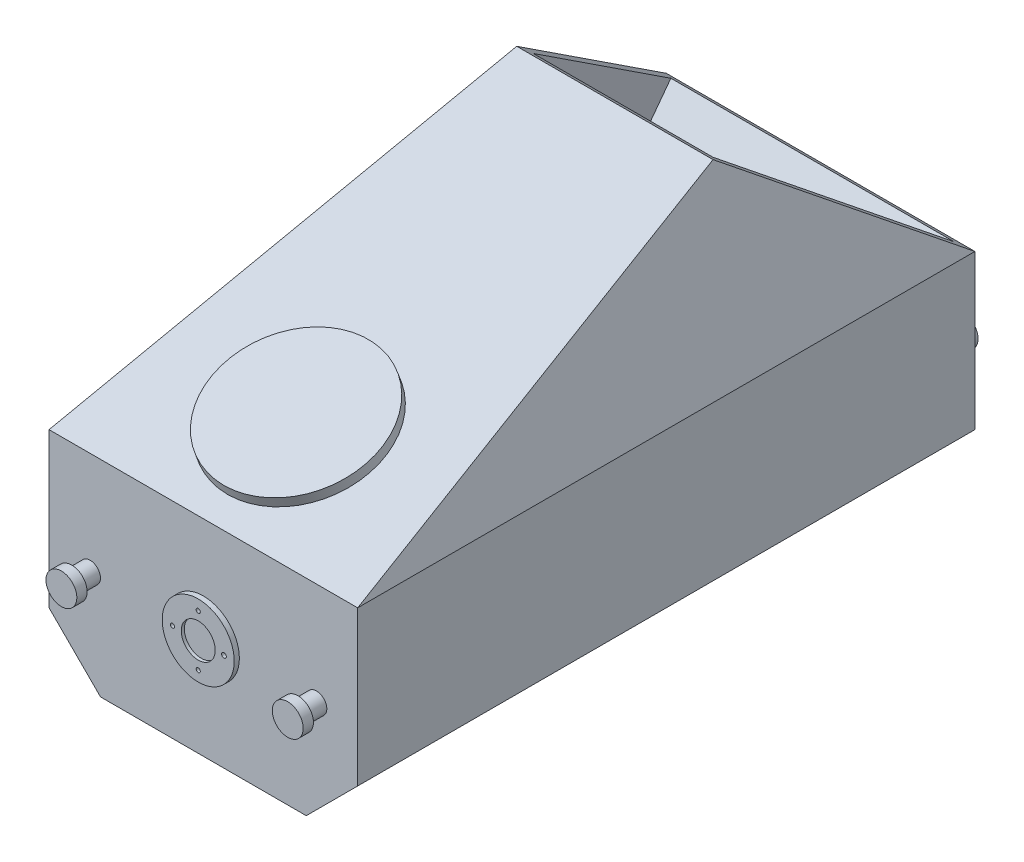
from build123d import *

# Parameters (mm, degrees)
SKETCH3_W            = 300
SKETCH3_H            = 200
BOSS_EXTRUDE2_DEPTH  = 300
SKETCH8_R            = 35
SKETCH8_R_2          = 2
SKETCH8_R_3          = 2.3
BOSS_EXTRUDE7_DEPTH  = 5
BOSS_EXTRUDE8_DEPTH  = 300
SKETCH19_W           = 200
SKETCH19_H           = 260
CUT_EXTRUDE5_DEPTH   = 150
CUT_EXTRUDE3_REACH   = 673.584
CUT_EXTRUDE4_DEPTH   = 200
CHAMFER2_SIZE        = 50
SKETCH4_R            = 10
BOSS_EXTRUDE9_DEPTH  = 18
SKETCH15_R           = 15
BOSS_EXTRUDE10_DEPTH = 10
BOSS_EXTRUDE11_START = 18
SKETCH16_R           = 10
BOSS_EXTRUDE11_DEPTH = 18
BOSS_EXTRUDE12_START = 10
SKETCH17_R           = 15
BOSS_EXTRUDE12_DEPTH = 10
SKETCH18_R           = 75
BOSS_EXTRUDE13_DEPTH = 10
CUT_EXTRUDE6_REACH   = 685.318
SKETCH20_R           = 35
SKETCH21_R           = 16.5
CUT_EXTRUDE7_DEPTH   = 3
CUT_EXTRUDE8_START   = -3
SKETCH22_R           = 16.5
CUT_EXTRUDE8_DEPTH   = 3
SKETCH23_R           = 2
SKETCH23_R_2         = 2.3
CUT_EXTRUDE9_DEPTH   = 20


with BuildPart() as part:
    # Sketch3 → Boss-Extrude2 (new body)
    with BuildSketch(Plane.XY):
        Rectangle(SKETCH3_W, SKETCH3_H)
    extrude(amount=-BOSS_EXTRUDE2_DEPTH)

    # Sketch8 → Boss-Extrude7 (add)
    with BuildSketch(Plane.XY):
        Circle(SKETCH8_R)
        with Locations((0, 25)):
            Circle(SKETCH8_R_2, mode=Mode.SUBTRACT)
        with Locations((0, -25)):
            Circle(SKETCH8_R_2, mode=Mode.SUBTRACT)
        with Locations((25, 0)):
            Circle(SKETCH8_R_3, mode=Mode.SUBTRACT)
        with Locations((-25, 0)):
            Circle(SKETCH8_R_2, mode=Mode.SUBTRACT)
    extrude(amount=BOSS_EXTRUDE7_DEPTH)

    # Mirror1: part across plane


with BuildPart() as part_1:
    add(part.part)
    add(part.part.mirror(Plane(origin=(0, 0, -300), x_dir=(1, 0, 0), z_dir=(0, 0, -1))))

    # Sketch10 → Boss-Extrude8 (add)
    with BuildSketch(Plane(origin=(150, 0, 0), x_dir=(0, 0, -1), z_dir=(1, 0, 0))):
        Polygon((0, 100), (400, 250), (600, 100), align=None)
    extrude(amount=-BOSS_EXTRUDE8_DEPTH)

    # Sketch19 → Cut-Extrude5 (cut)
    with BuildSketch(Plane.XZ.offset(100)):
        with Locations((0, -140)):
            Rectangle(SKETCH19_W, SKETCH19_H)
    extrude(amount=-CUT_EXTRUDE5_DEPTH, mode=Mode.SUBTRACT)

    # Cut-Extrude3: up to this plane
    cut_extrude3_end = Plane(origin=(-768.465843843, 250, -400), z_dir=(0, 0.7999999999999999, -0.6000000000000001))
    # Sketch11 → Cut-Extrude3 (cut, up to the surface)
    with BuildSketch(Plane.XY, mode=Mode.PRIVATE) as cut_extrude3_sk1:
        Polygon((150, 100), (95.40446486, 250), (150, 250), align=None)
    cut_extrude3_tool1 = split(extrude(cut_extrude3_sk1.sketch, amount=-CUT_EXTRUDE3_REACH, mode=Mode.PRIVATE), bisect_by=cut_extrude3_end, keep=Keep.BOTH, mode=Mode.PRIVATE)
    add(cut_extrude3_tool1.solids().sort_by_distance((131.801488, 200, 0))[0], mode=Mode.SUBTRACT)
    # Sketch11 → Cut-Extrude3 (cut, up to the surface)
    with BuildSketch(Plane.XY, mode=Mode.PRIVATE) as cut_extrude3_sk2:
        Polygon((-150, 100), (-95.40446486, 250), (-150, 250), align=None)
    cut_extrude3_tool2 = split(extrude(cut_extrude3_sk2.sketch, amount=-CUT_EXTRUDE3_REACH, mode=Mode.PRIVATE), bisect_by=cut_extrude3_end, keep=Keep.BOTH, mode=Mode.PRIVATE)
    add(cut_extrude3_tool2.solids().sort_by_distance((-131.801488, 200, 0))[0], mode=Mode.SUBTRACT)

    # Sketch14 → Cut-Extrude4 (cut)
    with BuildSketch(Plane(origin=(0, 352, -264), x_dir=(1, 0, 0), z_dir=(0, 0.7999999999999999, -0.6000000000000002))):
        Polygon((-137.580501971, 410), (137.580501971, 410), (87.352609643, 180), (-87.352609643, 180), align=None)
    extrude(amount=-CUT_EXTRUDE4_DEPTH, mode=Mode.SUBTRACT)

    # Chamfer2
    chamfer2_edges = [part_1.edges().sort_by_distance(p)[0] for p in [
        (150, -100, -300),
        (-150, -100, -300),
    ]]
    chamfer(chamfer2_edges, length=CHAMFER2_SIZE - 0.0001)  # a hair under: the kernel refuses the full size

    # Sketch4 → Boss-Extrude9 (add)
    with BuildSketch(Plane.XY):
        with Locations(Location((-110, 0, 0), (0, 0, 180))):
            Circle(SKETCH4_R)
        with Locations(Location((110, 0, 0), (0, 0, 180))):
            Circle(SKETCH4_R)
    extrude(amount=BOSS_EXTRUDE9_DEPTH)

    # Sketch15 → Boss-Extrude10 (add)
    with BuildSketch(Plane.XY.offset(18)):
        with Locations((-110, 0)):
            Circle(SKETCH15_R)
        with Locations((110, 0)):
            Circle(SKETCH15_R)
    extrude(amount=BOSS_EXTRUDE10_DEPTH)

    # Sketch16 → Boss-Extrude11 (add)
    with BuildSketch(Plane(origin=(0, 0, -600), x_dir=(-1, 0, 0), z_dir=(0, 0, -1)).offset(BOSS_EXTRUDE11_START)):
        with Locations((110, 0)):
            Circle(SKETCH16_R)
        with Locations((-110, 0)):
            Circle(SKETCH16_R)
    extrude(amount=-BOSS_EXTRUDE11_DEPTH)

    # Sketch17 → Boss-Extrude12 (add)
    with BuildSketch(Plane(origin=(0, 0, -618), x_dir=(-1, 0, 0), z_dir=(0, 0, -1)).offset(BOSS_EXTRUDE12_START)):
        with Locations(Location((-110, 0, 0), (0, 0, 180))):
            Circle(SKETCH17_R)
        with Locations(Location((110, 0, 0), (0, 0, 180))):
            Circle(SKETCH17_R)
    extrude(amount=-BOSS_EXTRUDE12_DEPTH)

    # Sketch18 → Boss-Extrude13 (add)
    with BuildSketch(Plane(origin=(0, 87.671232877, 32.876712329), x_dir=(1, 0, 0), z_dir=(0, 0.9363291775690445, 0.35112344158839187))):
        with Locations(Location((0, 135.112344159, 0), (0, 0, 270))):
            Circle(SKETCH18_R)
    extrude(amount=BOSS_EXTRUDE13_DEPTH)

    # Cut-Extrude6: up to this plane
    cut_extrude6_end = Plane(origin=(-137.580501971, -54, -472), z_dir=(0, -0.6000000000000002, -0.7999999999999999))
    # Sketch20 → Cut-Extrude6 (cut, up to the surface)
    with BuildSketch(Plane(origin=(0, 0, -590), x_dir=(-1, 0, 0), z_dir=(0, 0, -1)), mode=Mode.PRIVATE) as cut_extrude6_sk1:
        with Locations(Location((0, 0, 0), (0, 0, 180))):
            Circle(SKETCH20_R)
    cut_extrude6_tool1 = split(extrude(cut_extrude6_sk1.sketch, amount=-CUT_EXTRUDE6_REACH, mode=Mode.PRIVATE), bisect_by=cut_extrude6_end, keep=Keep.BOTH, mode=Mode.PRIVATE)
    add(cut_extrude6_tool1.solids().sort_by_distance((0, 0, -590))[0], mode=Mode.SUBTRACT)

    # Sketch21 → Cut-Extrude7 (cut)
    with BuildSketch(Plane(origin=(0, 0, -605), x_dir=(-1, 0, 0), z_dir=(0, 0, -1))):
        Circle(SKETCH21_R)
    extrude(amount=-CUT_EXTRUDE7_DEPTH, mode=Mode.SUBTRACT)

    # Sketch22 → Cut-Extrude8 (cut)
    with BuildSketch(Plane.XY.offset(5).offset(CUT_EXTRUDE8_START)):
        with Locations(Location((0, 0, 0), (0, 0, 180))):
            Circle(SKETCH22_R)
    extrude(amount=CUT_EXTRUDE8_DEPTH, mode=Mode.SUBTRACT)

    # Sketch23 → Cut-Extrude9 (cut)
    with BuildSketch(Plane.XY.offset(5)):
        with Locations((0, 25)):
            Circle(SKETCH23_R)
        with Locations((25, 0)):
            Circle(SKETCH23_R_2)
        with Locations((0, -25)):
            Circle(SKETCH23_R)
        with Locations((-25, 0)):
            Circle(SKETCH23_R)
    extrude(amount=-CUT_EXTRUDE9_DEPTH, mode=Mode.SUBTRACT)


solid = part_1.part
